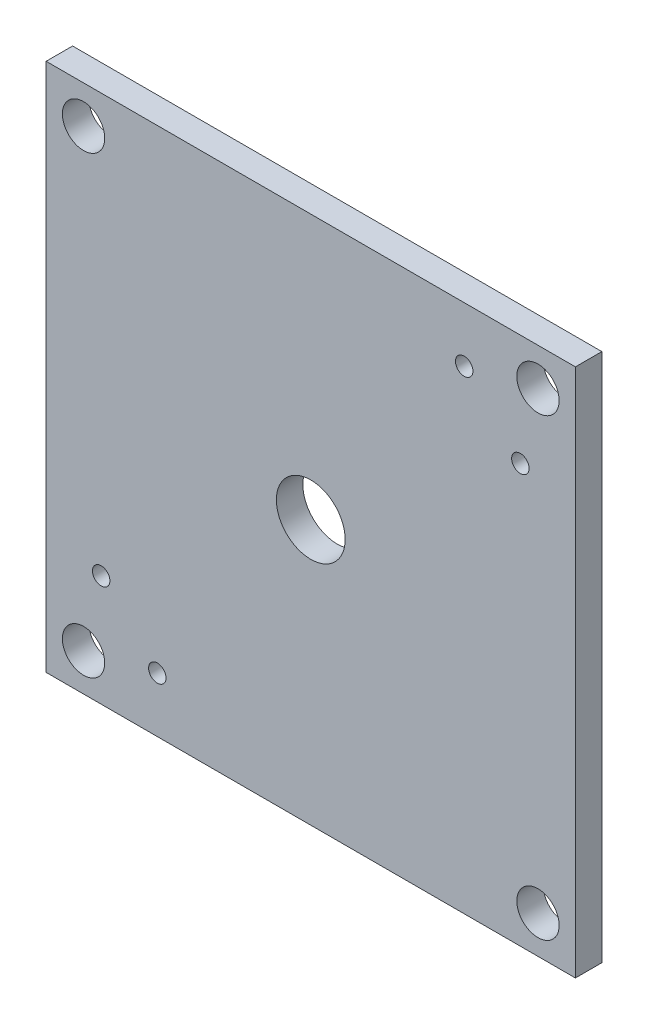
from build123d import *

# Parameters (mm, degrees)
SKETCH1_W                  = 100
SKETCH1_H                  = 100
MAINBODY_DEPTH             = 5
SKETCH2_R                  = 6.5
SKETCH2_R_2                = 4
BEARING_BUSHINGHOLES_DEPTH = 71.887234394
M4_TAPPED_HOLE1_D          = 3.3


with BuildPart() as part:
    # Sketch1 → MainBody (new body)
    with BuildSketch(Plane.XY):
        Rectangle(SKETCH1_W, SKETCH1_H)
    extrude(amount=MAINBODY_DEPTH)

    # Sketch2 → Bearing&BushingHoles (cut, through all)
    with BuildSketch(Plane.XY.offset(5)):
        Circle(SKETCH2_R)
        with Locations((-42.928932188, -42.928932188)):
            Circle(SKETCH2_R_2)
        with Locations((42.928932188, -42.928932188)):
            Circle(SKETCH2_R_2)
        with Locations((42.928932188, 42.928932188)):
            Circle(SKETCH2_R_2)
        with Locations((-42.928932188, 42.928932188)):
            Circle(SKETCH2_R_2)
    extrude(amount=-BEARING_BUSHINGHOLES_DEPTH, mode=Mode.SUBTRACT)

    # M4 Tapped Hole1 (through all)
    with Locations(Plane(origin=(-39.597979746, -28.991378029, 0), x_dir=(-1, 0, 0), z_dir=(0, 0, -1))):
        with Locations((0, 0), (-10.606601717, -10.606601717), (-68.589357775, 68.589357775), (-79.195959492, 57.982756058)):
            Hole(M4_TAPPED_HOLE1_D / 2)


solid = part.part
